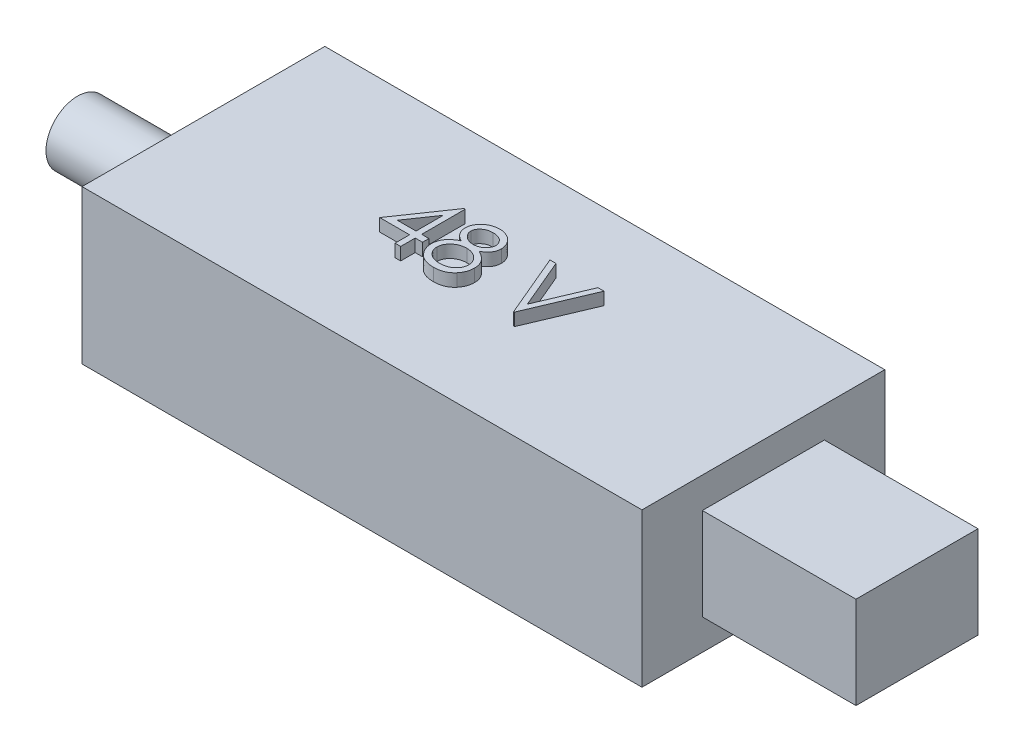
from build123d import *

# Parameters (mm, degrees)
SKETCH1_W           = 113
SKETCH1_H           = 49
BOSS_EXTRUDE1_DEPTH = 31
SKETCH2_W           = 24.62687601
SKETCH2_H           = 18.598470566
BOSS_EXTRUDE2_DEPTH = 31
SKETCH3_R           = 6.368506264
BOSS_EXTRUDE3_DEPTH = 25.4
BOSS_EXTRUDE4_DEPTH = 2.54


with BuildPart() as part:
    # Sketch1 → Boss-Extrude1 (new body)
    with BuildSketch(Plane(origin=(0, 0, 0), x_dir=(1, 0, 0), z_dir=(0, 1, 0))):
        Rectangle(SKETCH1_W, SKETCH1_H)
    extrude(amount=BOSS_EXTRUDE1_DEPTH)

    # Sketch2 → Boss-Extrude2 (add)
    with BuildSketch(Plane(origin=(56.5, 0, 0), x_dir=(0, 0, -1), z_dir=(1, 0, 0))):
        with Locations((0, 15.5)):
            Rectangle(SKETCH2_W, SKETCH2_H)
    extrude(amount=BOSS_EXTRUDE2_DEPTH)

    # Sketch3 → Boss-Extrude3 (add)
    with BuildSketch(Plane.ZY.offset(56.5)):
        with Locations((0, 15.5)):
            Circle(SKETCH3_R)
    extrude(amount=BOSS_EXTRUDE3_DEPTH)

    # Sketch5 → Boss-Extrude4 (add)
    # profile 1 of 3: a face of its own
    with BuildSketch(Plane(origin=(0, 31, 0), x_dir=(1, 0, 0), z_dir=(0, 1, 0))):
        Polygon((-11.579604813, 7.682518426), (-11.348094396, 7.682518426), (-11.348094396, -1.109789266), (-9.882709781, -1.109789266), (-9.882709781, -2.412353369), (-11.348094396, -2.412353369), (-11.348094396, -5.343122599), (-12.487837986, -5.343122599), (-12.487837986, -2.412353369), (-18.51219696, -2.412353369), align=None)
        Polygon((-12.487837986, -1.109789266), (-12.487837986, 4.405755606), (-16.273414909, -1.109789266), align=None, mode=Mode.SUBTRACT)
    # profile 2 of 3: a face of its own
    with BuildSketch(Plane(origin=(0, 31, 0), x_dir=(1, 0, 0), z_dir=(0, 1, 0))):
        with BuildLine():
            add(Edge.make_bspline(
                [(-2.568507057, 1.731937497), (-2.464553757, 1.677734057), (-2.261810106, 1.572019246), (-1.973058522, 1.401799957), (-1.70917066, 1.222399885), (-1.462824907, 1.042292623), (-1.23834932, 0.854580631), (-1.038253879, 0.658517464), (-0.857595944, 0.458997034), (-0.700018756, 0.252640757), (-0.561418806, 0.039996859), (-0.441631915, -0.179492789), (-0.339243779, -0.405347172), (-0.258098259, -0.640031669), (-0.191253472, -0.880098904), (-0.145259133, -1.128648724), (-0.12052346, -1.384043332), (-0.115846909, -1.556648313), (-0.113479012, -1.644044074)],
                knots=[0, 0, 0, 0, 1.272397273, 2.481599622, 3.635517121, 4.734568067, 5.792894095, 6.808321871, 7.773003508, 8.711915296, 9.623354172, 10.525449501, 11.423591555, 12.311487226, 13.218079475, 14.126165749, 15.051214107, 16, 16, 16, 16], degree=3))
            add(Edge.make_bspline(
                [(-0.113479012, -1.644044074), (-0.116278166, -1.766318704), (-0.121818743, -2.008346075), (-0.170078685, -2.365564823), (-0.24233435, -2.712499003), (-0.347851438, -3.049072555), (-0.48469717, -3.373428281), (-0.653341689, -3.685843831), (-0.844245205, -3.99143961), (-0.997560473, -4.17947001), (-1.075137666, -4.274612984)],
                knots=[0, 0, 0, 0, 1.025265484, 2.029385089, 3.018602448, 3.995076438, 4.983346944, 5.966715145, 6.97116228, 8, 8, 8, 8], degree=3))
            add(Edge.make_bspline(
                [(-1.075137666, -4.274612984), (-1.176144301, -4.385624679), (-1.376909405, -4.606276266), (-1.720836028, -4.89275492), (-2.098286863, -5.133508436), (-2.507801384, -5.329712167), (-2.948284924, -5.482423712), (-3.419643626, -5.592160849), (-3.92279641, -5.655016521), (-4.268619119, -5.664102426), (-4.446031095, -5.668763625)],
                knots=[0, 0, 0, 0, 0.954267603, 1.896743057, 2.838368354, 3.796610408, 4.779680527, 5.799409237, 6.871065594, 8, 8, 8, 8], degree=3))
            add(Edge.make_bspline(
                [(-4.446031095, -5.668763625), (-4.616622534, -5.664581776), (-4.948576146, -5.656444324), (-5.431749016, -5.601310244), (-5.882138441, -5.504689127), (-6.302363183, -5.372447259), (-6.68988987, -5.200415859), (-7.043614266, -4.986299633), (-7.368639822, -4.738716972), (-7.655102741, -4.450557317), (-7.909423666, -4.141918751), (-8.132827744, -3.823505767), (-8.318516543, -3.495289298), (-8.475732003, -3.162163338), (-8.596084543, -2.819458721), (-8.679440849, -2.468938673), (-8.732379217, -2.111215441), (-8.739422764, -1.869800585), (-8.742966191, -1.748350965)],
                knots=[0, 0, 0, 0, 1.256902934, 2.445805442, 3.576955095, 4.645999104, 5.686449165, 6.692658513, 7.68621702, 8.689161843, 9.678783111, 10.630372946, 11.551080876, 12.453998257, 13.34127905, 14.221779781, 15.105423033, 16, 16, 16, 16], degree=3))
            add(Edge.make_bspline(
                [(-8.742966191, -1.748350965), (-8.740869309, -1.659236182), (-8.736725128, -1.483113918), (-8.708041822, -1.222911498), (-8.661928262, -0.969651238), (-8.599301091, -0.722397682), (-8.51442508, -0.482950893), (-8.411946483, -0.250176317), (-8.292450541, -0.023811158), (-8.154270314, 0.197382496), (-7.993517255, 0.410305297), (-7.811494869, 0.618570764), (-7.604565174, 0.818947253), (-7.37503024, 1.013882909), (-7.125513197, 1.206835728), (-6.849533015, 1.387377944), (-6.554405815, 1.56829113), (-6.344654771, 1.676452768), (-6.237056736, 1.731937497)],
                knots=[0, 0, 0, 0, 0.941657376, 1.861047343, 2.762797495, 3.66048619, 4.553285746, 5.444104102, 6.34607688, 7.256116206, 8.197091036, 9.162375105, 10.176350973, 11.237807142, 12.343728897, 13.50695164, 14.721116704, 16, 16, 16, 16], degree=3))
            add(Edge.make_bspline(
                [(-6.237056736, 1.731937497), (-6.384345438, 1.812255086), (-6.669537592, 1.967772419), (-7.047160993, 2.25351083), (-7.371521255, 2.562983758), (-7.633702659, 2.902726156), (-7.840067601, 3.262124814), (-7.981649395, 3.638931101), (-8.077430922, 4.026158142), (-8.086919009, 4.290703484), (-8.09168414, 4.423564099)],
                knots=[0, 0, 0, 0, 1.166880483, 2.259407225, 3.286803203, 4.280235371, 5.237608625, 6.161067461, 7.076446754, 8, 8, 8, 8], degree=3))
            add(Edge.make_bspline(
                [(-8.09168414, 4.423564099), (-8.085749887, 4.558900954), (-8.073821003, 4.830951634), (-7.977361525, 5.235922425), (-7.82017157, 5.633673961), (-7.606372523, 6.022278404), (-7.340081768, 6.388583469), (-7.020598587, 6.71711776), (-6.655552339, 7.004905139), (-6.246765221, 7.246481537), (-5.80685088, 7.443090813), (-5.342699539, 7.57872109), (-4.862398264, 7.667389285), (-4.535472254, 7.677428289), (-4.36970898, 7.682518426)],
                knots=[0, 0, 0, 0, 0.888701115, 1.786444228, 2.72001202, 3.692817113, 4.693886446, 5.687152267, 6.695133018, 7.739871481, 8.800368666, 9.853104506, 10.91144658, 12, 12, 12, 12], degree=3))
            add(Edge.make_bspline(
                [(-4.36970898, 7.682518426), (-4.208223708, 7.677270267), (-3.88979315, 7.666921495), (-3.421726929, 7.580609109), (-2.973870946, 7.436447708), (-2.547769621, 7.240877784), (-2.15105113, 6.999988027), (-1.800522751, 6.708247713), (-1.490887382, 6.381162657), (-1.234766866, 6.014968668), (-1.023718667, 5.627857451), (-0.876758255, 5.222827161), (-0.782589663, 4.808629147), (-0.770712028, 4.528365533), (-0.764761063, 4.387947112)],
                knots=[0, 0, 0, 0, 1.072916533, 2.115669174, 3.151510826, 4.193348718, 5.225979165, 6.227137561, 7.216255879, 8.211077061, 9.189680878, 10.138522389, 11.067357538, 12, 12, 12, 12], degree=3))
            add(Edge.make_bspline(
                [(-0.764761063, 4.387947112), (-0.769966469, 4.250146075), (-0.78018959, 3.979512669), (-0.866186513, 3.584990724), (-1.011014822, 3.215522182), (-1.208750785, 2.866914613), (-1.46647184, 2.545490322), (-1.780737814, 2.247161988), (-2.149043178, 1.969478925), (-2.425761251, 1.812774118), (-2.568507057, 1.731937497)],
                knots=[0, 0, 0, 0, 0.975232327, 1.915300861, 2.843280834, 3.77672583, 4.742871857, 5.749627742, 6.839139064, 8, 8, 8, 8], degree=3))
        make_face()
        with BuildLine():
            add(Edge.make_bspline(
                [(-4.433310742, 6.379954324), (-4.522395095, 6.377590525), (-4.696683041, 6.372965902), (-4.952238505, 6.348804562), (-5.195252524, 6.301802889), (-5.428264143, 6.239250993), (-5.64807869, 6.154748865), (-5.857681503, 6.055344117), (-6.053505306, 5.934490679), (-6.237914034, 5.798922904), (-6.403923987, 5.649814359), (-6.551260503, 5.494461722), (-6.673645374, 5.329813871), (-6.777571686, 5.159966394), (-6.852978906, 4.979878303), (-6.909455095, 4.795070892), (-6.947632715, 4.603208784), (-6.950493445, 4.472084874), (-6.95194055, 4.405755606)],
                knots=[0, 0, 0, 0, 1.203892937, 2.355340988, 3.463153438, 4.544400666, 5.610487187, 6.640501085, 7.674077295, 8.714426146, 9.728707835, 10.68524104, 11.601827946, 12.495867327, 13.368432065, 14.231010473, 15.105153427, 16, 16, 16, 16], degree=3))
            add(Edge.make_bspline(
                [(-6.95194055, 4.405755606), (-6.94944639, 4.339423471), (-6.944517572, 4.208341644), (-6.906398964, 4.014772359), (-6.849586948, 3.824556706), (-6.760140263, 3.642217686), (-6.65285662, 3.461430068), (-6.520444692, 3.286712227), (-6.362641648, 3.117456117), (-6.184742079, 2.955101344), (-5.990934499, 2.803068689), (-5.785615256, 2.671086002), (-5.571361208, 2.560653659), (-5.350373699, 2.468744104), (-5.120400476, 2.39729776), (-4.882850701, 2.346611529), (-4.63768445, 2.315108283), (-4.471566342, 2.311345377), (-4.387517473, 2.309441503)],
                knots=[0, 0, 0, 0, 0.873023192, 1.725219244, 2.590779336, 3.480155217, 4.391973325, 5.357036234, 6.360879153, 7.436073238, 8.526419356, 9.601555421, 10.645666583, 11.697338044, 12.750135903, 13.812665442, 14.89329948, 16, 16, 16, 16], degree=3))
            add(Edge.make_bspline(
                [(-4.387517473, 2.309441503), (-4.279567097, 2.312608764), (-4.064732563, 2.318912003), (-3.748033274, 2.37751769), (-3.440103107, 2.469704877), (-3.144233368, 2.595833898), (-2.868082444, 2.754140704), (-2.621919911, 2.943671941), (-2.407845471, 3.160051265), (-2.228083829, 3.399910126), (-2.088710957, 3.655185889), (-1.980210112, 3.911364095), (-1.916850845, 4.171177904), (-1.90858653, 4.345229459), (-1.904504653, 4.431196311)],
                knots=[0, 0, 0, 0, 1.076279235, 2.141928126, 3.20205304, 4.278698113, 5.344010996, 6.36967002, 7.368914609, 8.37248503, 9.349703398, 10.264243087, 11.142681841, 12, 12, 12, 12], degree=3))
            add(Edge.make_bspline(
                [(-1.904504653, 4.431196311), (-1.906434681, 4.491532327), (-1.910265511, 4.611290671), (-1.941834285, 4.788141311), (-1.993998022, 4.960968657), (-2.064621198, 5.131200439), (-2.157548168, 5.296448238), (-2.267726791, 5.459309729), (-2.401564839, 5.616121215), (-2.551774754, 5.770537062), (-2.722119523, 5.913444805), (-2.912270862, 6.039119325), (-3.121253899, 6.145844162), (-3.349073575, 6.232526215), (-3.594890871, 6.297631312), (-3.857573586, 6.34638606), (-4.139312008, 6.373865636), (-4.333185676, 6.377880742), (-4.433310742, 6.379954324)],
                knots=[0, 0, 0, 0, 0.814439003, 1.616544685, 2.417341072, 3.248991801, 4.09997495, 4.973547432, 5.9003056, 6.880240646, 7.880314356, 8.896779544, 9.951930927, 11.043077905, 12.18215768, 13.381699519, 14.647792085, 16, 16, 16, 16], degree=3))
        make_face(mode=Mode.SUBTRACT)
        with BuildLine():
            add(Edge.make_bspline(
                [(-4.359532698, 1.006877401), (-4.472474834, 1.004868473), (-4.694039747, 1.000927448), (-5.0186406, 0.957059832), (-5.330164944, 0.895993178), (-5.627562427, 0.803352707), (-5.910707464, 0.68289687), (-6.181132855, 0.53799154), (-6.436769811, 0.366703217), (-6.674088275, 0.17120807), (-6.890798642, -0.039464806), (-7.080929616, -0.262484554), (-7.242392048, -0.493706316), (-7.372415558, -0.73606669), (-7.479138129, -0.984433735), (-7.549219912, -1.244992724), (-7.594147837, -1.512734535), (-7.600180814, -1.694744035), (-7.603222601, -1.786512022)],
                knots=[0, 0, 0, 0, 1.140299081, 2.23698856, 3.303958914, 4.344563908, 5.37730929, 6.408454204, 7.439741482, 8.480804886, 9.510774543, 10.48932336, 11.43758569, 12.353841022, 13.263987381, 14.161954604, 15.073269652, 16, 16, 16, 16], degree=3))
            add(Edge.make_bspline(
                [(-7.603222601, -1.786512022), (-7.59827592, -1.90056131), (-7.588461818, -2.126832433), (-7.510604872, -2.46125272), (-7.385653072, -2.78499769), (-7.211390145, -3.095429062), (-6.99560781, -3.385533733), (-6.730263198, -3.638404433), (-6.431846444, -3.863090941), (-6.090260516, -4.044811734), (-5.717140083, -4.189935922), (-5.31258438, -4.289924701), (-4.88239939, -4.356115105), (-4.585366012, -4.362785077), (-4.433310742, -4.366199522)],
                knots=[0, 0, 0, 0, 0.898778495, 1.783155532, 2.693654817, 3.627872908, 4.583023416, 5.533784346, 6.509005473, 7.520592997, 8.575161974, 9.658835044, 10.801527049, 12, 12, 12, 12], degree=3))
            add(Edge.make_bspline(
                [(-4.433310742, -4.366199522), (-4.314473693, -4.363917846), (-4.082941013, -4.359472409), (-3.745171998, -4.32023197), (-3.426421779, -4.258003332), (-3.127308482, -4.167493894), (-2.844483692, -4.057003979), (-2.582742664, -3.914865283), (-2.335352009, -3.753203997), (-2.114502192, -3.5614044), (-1.913358835, -3.356464519), (-1.73797803, -3.139512077), (-1.585732059, -2.916443354), (-1.466239734, -2.68221731), (-1.370713042, -2.441327648), (-1.302047572, -2.191553079), (-1.259679591, -1.932127519), (-1.255394626, -1.756145176), (-1.253222601, -1.666940708)],
                knots=[0, 0, 0, 0, 1.224942928, 2.386581632, 3.501229538, 4.569074225, 5.605009692, 6.626002462, 7.634866581, 8.645888296, 9.63523824, 10.59253846, 11.518950513, 12.414518923, 13.29783783, 14.186679152, 15.080837789, 16, 16, 16, 16], degree=3))
            add(Edge.make_bspline(
                [(-1.253222601, -1.666940708), (-1.256509538, -1.580300072), (-1.262990801, -1.409459873), (-1.304126796, -1.156307048), (-1.376392979, -0.911731122), (-1.47555239, -0.672789672), (-1.607563312, -0.444324108), (-1.763028983, -0.220382572), (-1.950604785, -0.007180616), (-2.162559062, 0.196937761), (-2.393550148, 0.385680577), (-2.639085217, 0.552647254), (-2.897274265, 0.693262076), (-3.167570944, 0.807621931), (-3.449375076, 0.897565035), (-3.742479387, 0.96039736), (-4.047227044, 0.999947348), (-4.254254718, 1.004541286), (-4.359532698, 1.006877401)],
                knots=[0, 0, 0, 0, 0.917430815, 1.809013306, 2.70690318, 3.612392954, 4.541220862, 5.495268465, 6.494511384, 7.542276156, 8.608045339, 9.649016899, 10.681629292, 11.715607085, 12.752076957, 13.808767841, 14.885711793, 16, 16, 16, 16], degree=3))
        make_face(mode=Mode.SUBTRACT)
    # profile 3 of 3: a face of its own
    with BuildSketch(Plane(origin=(0, 31, 0), x_dir=(1, 0, 0), z_dir=(0, 1, 0))):
        Polygon((6.073700475, 7.356877401), (7.294854322, 7.356877401), (11.528187655, -2.651495997), (15.761520988, 7.356877401), (16.982674834, 7.356877401), (11.609597911, -5.343122599), (11.446777399, -5.343122599), align=None)
    extrude(amount=BOSS_EXTRUDE4_DEPTH)


solid = part.part
